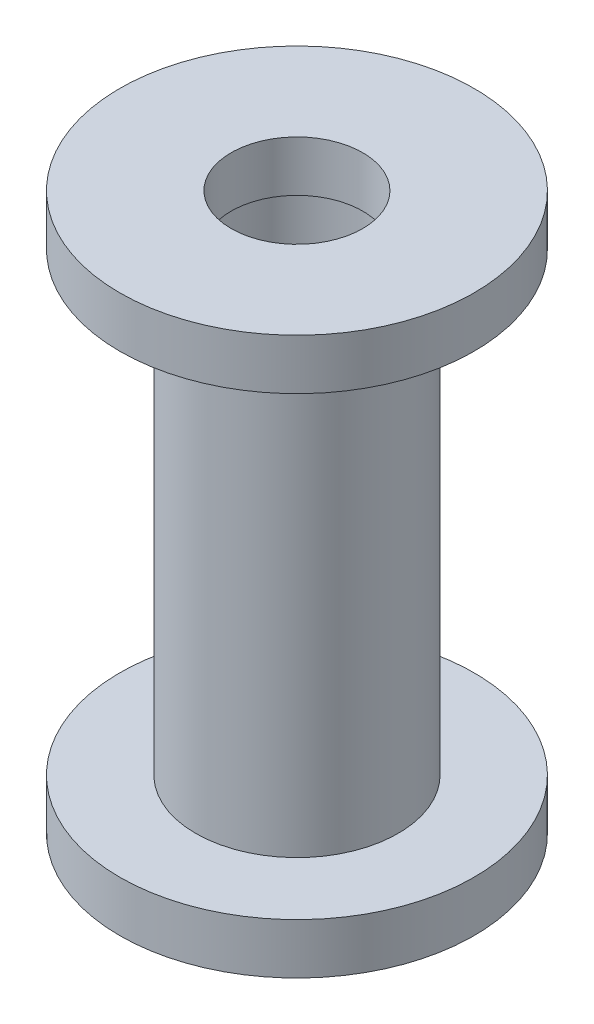
from build123d import *

# Parameters (mm, degrees)
SKETCH1_R           = 7
BOSS_EXTRUDE1_DEPTH = 2
SKETCH2_R           = 4
BOSS_EXTRUDE2_DEPTH = 18
SKETCH3_R           = 2.75
CUT_EXTRUDE1_DEPTH  = 23.315913604
SKETCH6_R           = 7
BOSS_EXTRUDE4_DEPTH = 2
SKETCH7_R           = 2.6
CUT_EXTRUDE2_DEPTH  = 2


with BuildPart() as part:
    # Sketch1 → Boss-Extrude1 (new body)
    with BuildSketch(Plane(origin=(0, 0, 0), x_dir=(1, 0, 0), z_dir=(0, 1, 0))):
        Circle(SKETCH1_R)
    extrude(amount=BOSS_EXTRUDE1_DEPTH)

    # Sketch2 → Boss-Extrude2 (add)
    with BuildSketch(Plane(origin=(0, 2, 0), x_dir=(1, 0, 0), z_dir=(0, 1, 0))):
        Circle(SKETCH2_R)
    extrude(amount=BOSS_EXTRUDE2_DEPTH)

    # Sketch3 → Cut-Extrude1 (cut, through all)
    with BuildSketch(Plane(origin=(0, 20, 0), x_dir=(1, 0, 0), z_dir=(0, 1, 0))):
        Circle(SKETCH3_R)
    extrude(amount=-CUT_EXTRUDE1_DEPTH, mode=Mode.SUBTRACT)

    # Sketch6 → Boss-Extrude4 (add)
    with BuildSketch(Plane(origin=(0, 20, 0), x_dir=(1, 0, 0), z_dir=(0, 1, 0))):
        Circle(SKETCH6_R)
    extrude(amount=BOSS_EXTRUDE4_DEPTH)

    # Sketch7 → Cut-Extrude2 (cut)
    with BuildSketch(Plane(origin=(0, 22, 0), x_dir=(1, 0, 0), z_dir=(0, 1, 0))):
        Circle(SKETCH7_R)
    extrude(amount=-CUT_EXTRUDE2_DEPTH, mode=Mode.SUBTRACT)


solid = part.part
